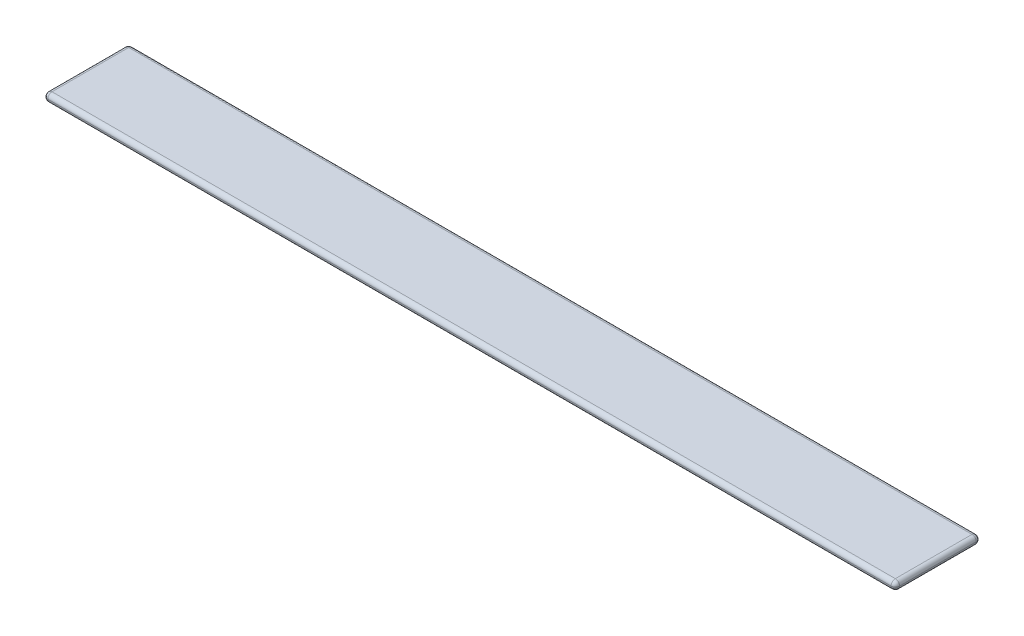
from build123d import *

# Parameters (mm, degrees)
SKETCH1_W           = 50
SKETCH1_H           = 5
BOSS_EXTRUDE1_DEPTH = 0.5
FILLET3_R           = 0.25


with BuildPart() as part:
    # Sketch1 → Boss-Extrude1 (new body)
    with BuildSketch(Plane(origin=(0, 0, 0), x_dir=(1, 0, 0), z_dir=(0, 1, 0))):
        with Locations((25, -2.5)):
            Rectangle(SKETCH1_W, SKETCH1_H)
    extrude(amount=BOSS_EXTRUDE1_DEPTH)

    # Fillet3
    fillet3_edges = [part.edges().sort_by_distance(p)[0] for p in [
        (50, 0.5, 2.5),
        (25, 0.5, 0),
        (0, 0.5, 2.5),
        (25, 0, 0),
        (50, 0, 2.5),
        (25, 0, 5),
        (0, 0, 2.5),
        (0, 0.25, 0),
        (50, 0.25, 0),
        (50, 0.25, 5),
        (0, 0.25, 5),
        (25, 0.5, 5),
    ]]
    fillet(fillet3_edges, radius=FILLET3_R - 0.0001)  # a hair under: the kernel refuses the full size


solid = part.part
